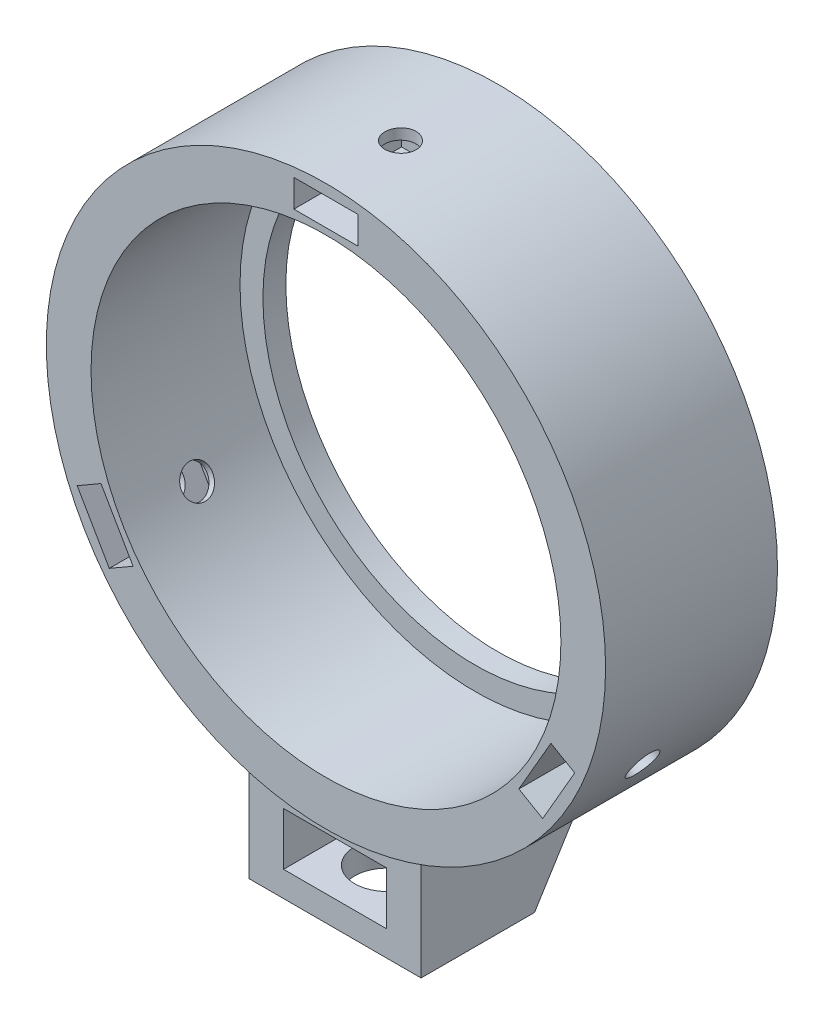
from build123d import *

# Parameters (mm, degrees)
SKETCH1_R                   = 30.988
BOSS_EXTRUDE1_DEPTH         = 19.05
SKETCH2_R                   = 26.035
CUT_EXTRUDE1_DEPTH          = 48.785089599
BOSS_EXTRUDE2_START         = -2.54
SKETCH4_R                   = 26.035
SKETCH4_R_2                 = 23.495
BOSS_EXTRUDE2_DEPTH         = 2.54
SKETCH11_W                  = 7.112
SKETCH11_H                  = 3.048
CUT_EXTRUDE3_DEPTH          = 11.938
CIRPATTERN2_COUNT           = 3
F_4_CLEARANCE_HOLE1_D       = 3.4544
F_4_CLEARANCE_HOLE1_DEPTH   = 34.456395212
SKETCH15_W                  = 19.05
SKETCH15_H                  = 17.653
BOSS_EXTRUDE3_DEPTH         = 12.7
CIRPATTERN3_COUNT           = 3
SKETCH16_W                  = 11.43
SKETCH16_H                  = 5.842
CUT_EXTRUDE4_DEPTH          = 55.322904735
CHAMFER2_SIZE               = 8.129699408
CHAMFER2_SIZE_2             = 5.08
F_1_4_CLEARANCE_HOLE1_D     = 7.14248
F_1_4_CLEARANCE_HOLE1_DEPTH = 2.811307748


with BuildPart() as part:
    # Sketch1 → Boss-Extrude1 (new body)
    with BuildSketch(Plane.XY):
        with Locations(Location((0, 0, 0), (0, 0, 180))):
            Circle(SKETCH1_R)
    extrude(amount=BOSS_EXTRUDE1_DEPTH)

    # Sketch2 → Cut-Extrude1 (cut, through all)
    with BuildSketch(Plane.XY.offset(19.05)):
        Circle(SKETCH2_R)
    extrude(amount=-CUT_EXTRUDE1_DEPTH, mode=Mode.SUBTRACT)

    # Sketch4 → Boss-Extrude2 (add)
    with BuildSketch(Plane(origin=(0, 0, 0), x_dir=(-1, 0, 0), z_dir=(0, 0, -1)).offset(BOSS_EXTRUDE2_START)):
        with Locations(Location((0, 0, 0), (0, 0, 180))):
            Circle(SKETCH4_R)
        Circle(SKETCH4_R_2, mode=Mode.SUBTRACT)
    extrude(amount=BOSS_EXTRUDE2_DEPTH)

    # Sketch11 → Cut-Extrude3 (cut)
    with BuildSketch(Plane.XY.offset(19.05)):
        with Locations((0, 28.2575)):
            Rectangle(SKETCH11_W, SKETCH11_H)
    cut_extrude3 = extrude(amount=-CUT_EXTRUDE3_DEPTH, mode=Mode.SUBTRACT)

    # CirPattern2: Cut-Extrude3 ×3 about axis
    cirpattern2_axis = Axis((0, 0, 0), (0, 0, 1))
    for i in range(1, CIRPATTERN2_COUNT):
        add(cut_extrude3.rotate(cirpattern2_axis, i * 360 / CIRPATTERN2_COUNT), mode=Mode.SUBTRACT)

    # #4 Clearance Hole1
    with Locations(Plane.XZ.offset(-12.7)):
        with Locations((0, 10.795)):
            f_4_clearance_hole1 = Hole(F_4_CLEARANCE_HOLE1_D / 2, depth=F_4_CLEARANCE_HOLE1_DEPTH)

    # Sketch15 → Boss-Extrude3 (add)
    with BuildSketch(Plane(origin=(0, -27.94, 0), x_dir=(1, 0, 0), z_dir=(0, 1, 0))):
        with Locations((0.381, -9.5885)):
            Rectangle(SKETCH15_W, SKETCH15_H)
    extrude(amount=-BOSS_EXTRUDE3_DEPTH)

    # CirPattern3: #4 Clearance Hole1 ×3 about axis
    cirpattern3_axis = Axis((0, 0, 19.05), (0, 0, 1))
    for i in range(1, CIRPATTERN3_COUNT):
        add(f_4_clearance_hole1.rotate(cirpattern3_axis, i * 360 / CIRPATTERN3_COUNT), mode=Mode.SUBTRACT)

    # Sketch16 → Cut-Extrude4 (cut, through all)
    with BuildSketch(Plane.XY.offset(18.415)):
        with Locations((0.381, -34.907692252)):
            Rectangle(SKETCH16_W, SKETCH16_H)
    extrude(amount=-CUT_EXTRUDE4_DEPTH, mode=Mode.SUBTRACT)

    # Chamfer2
    # the kernel refuses this chamfer: 8.129699408, 5.08 mm, written as the material it takes off along each edge
    with BuildSketch(Plane(origin=(-30.162101737, -40.64, 0.762), x_dir=(0, 0.9997899140358644, -0.020497019104217945), z_dir=(1, 0, 0))) as chamfer2_piece_1:
        Polygon((CHAMFER2_SIZE * 0.999789913978, CHAMFER2_SIZE * 0.020497019103), (-CHAMFER2_SIZE_2 * 0.0204970191042, CHAMFER2_SIZE_2 * 0.999789914036), (0, 0), align=None)
    extrude(amount=61.086203475, mode=Mode.SUBTRACT)

    # 1/4 Clearance Hole1
    with Locations(Plane(origin=(0, -40.64, 0), x_dir=(-1, 0, 0), z_dir=(0, -1, 0))):
        with Locations((0, -12.289529053)):
            Hole(F_1_4_CLEARANCE_HOLE1_D / 2, depth=F_1_4_CLEARANCE_HOLE1_DEPTH)


solid = part.part
